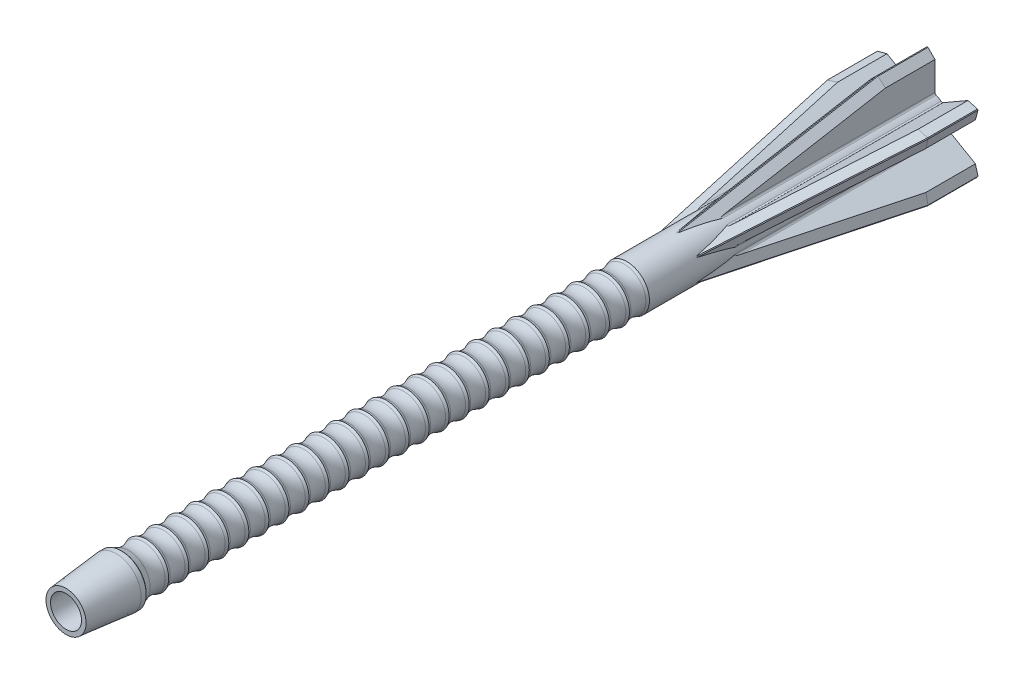
from build123d import *

# Parameters (mm, degrees)
SKETCH_2_R                           = 2.25
EXTRUDE_1_DEPTH                      = 30
FILLET_1_R                           = 2
PATTERN_LINEAR_1_COUNT               = 25
PATTERN_LINEAR_1_PITCH               = 2
FILLET_1_OF_PATTERN_LINEAR_1_R       = 2
SKETCH_6_R                           = 2.5
EXTRUDE_3_DEPTH                      = 6
CHAMFER_1_SIZE                       = 5
CHAMFER_1_SIZE2                      = 0.5
EXTRUDE_4_DEPTH                      = 0.75
CHAMFER_3_SIZE                       = 0.7
PATTERN_CIRCULAR_1_COUNT             = 6
CHAMFER_3_OF_PATTERN_CIRCULAR_1_SIZE = 0.7
SKETCH_10_R                          = 1.5
CUT_EXTRUDE_3_DEPTH                  = 1
CHAMFER_4_SIZE                       = 1
FILLET_3_R                           = 0.2
SKETCH_7_R                           = 1.55
CUT_EXTRUDE_1_DEPTH                  = 60
CHAMFER_6_SIZE                       = 0.4


with BuildPart() as part:
    # 스케치2 → 보스-돌출1 (new body)
    with BuildSketch(Plane.XY):
        Circle(SKETCH_2_R)
    extrude(amount=EXTRUDE_1_DEPTH)

    # 스케치3 → 회전1 (revolve)
    with BuildSketch(Plane(origin=(0, 0, 0), x_dir=(0, 0, -1), z_dir=(1, 0, 0))):
        Polygon((-30, 2.25), (-31, 1.85), (-32, 2.25), (-32, 0), (-30, 0), align=None)
    revolve_1 = revolve(axis=Axis((0, 0, 30), (0, 0, 1)))

    # 필렛1
    fillet_1_edges = [part.edges().sort_by_distance(p)[0] for p in [
        (0, -1.85, 31),
    ]]
    fillet(fillet_1_edges, radius=FILLET_1_R)

    # 선형 패턴1: 회전1 ×25
    with Locations(*[(0, 0, i * PATTERN_LINEAR_1_PITCH) for i in range(1, PATTERN_LINEAR_1_COUNT)]):
        add(revolve_1)

    # 필렛1 of 선형 패턴1
    fillet_1_of_pattern_linear_1_edges = [part.edges().sort_by_distance(p)[0] for p in [
        (0, -1.85, 33),
        (0, -1.85, 35),
        (0, -1.85, 37),
        (0, -1.85, 39),
        (0, -1.85, 41),
        (0, -1.85, 43),
        (0, -1.85, 45),
        (0, -1.85, 47),
        (0, -1.85, 49),
        (0, -1.85, 51),
        (0, -1.85, 53),
        (0, -1.85, 55),
        (0, -1.85, 57),
        (0, -1.85, 59),
        (0, -1.85, 61),
        (0, -1.85, 63),
        (0, -1.85, 65),
        (0, -1.85, 67),
        (0, -1.85, 69),
        (0, -1.85, 71),
        (0, -1.85, 73),
        (0, -1.85, 75),
        (0, -1.85, 77),
        (0, -1.85, 79),
    ]]
    fillet(fillet_1_of_pattern_linear_1_edges, radius=FILLET_1_OF_PATTERN_LINEAR_1_R)

    # 스케치6 → 보스-돌출3 (add)
    with BuildSketch(Plane.XY.offset(80)):
        Circle(SKETCH_6_R)
    extrude(amount=EXTRUDE_3_DEPTH)

    # 모따기1
    chamfer_1_edges = [part.edges().sort_by_distance(p)[0] for p in [
        (-2.5, 0, 86),
    ]]
    chamfer_1_side = [part.faces().sort_by_distance(p)[0] for p in [
        (-2.5, 0, 83),
    ]]
    chamfer(chamfer_1_edges, length=CHAMFER_1_SIZE, length2=CHAMFER_1_SIZE2, reference=chamfer_1_side[0])

    # 모따기2: read off the stored shape, not the designer's step
    # 모따기2 outline → 모따기2 (revolve, cut)
    with BuildSketch(Plane.XZ):
        Polygon((2.416666667, 80.416666667), (2.25, 80), (2.5, 80), (2.5, 80.5), align=None)
    revolve(axis=Axis((0, 0, 0), (0, 0, 1)), mode=Mode.SUBTRACT)

    # 스케치8 → 보스-돌출4 (add, symmetric)
    with BuildSketch(Plane(origin=(0, 0, 0), x_dir=(0, 0, -1), z_dir=(1, 0, 0))):
        Polygon((0, 2.25), (0, 5.8), (-5, 5.8), (-25, 2.25), (-25, 1.021312106), (0, 1.021312106), align=None)
    extrude_4 = extrude(amount=EXTRUDE_4_DEPTH, both=True)

    # 모따기3
    # the kernel refuses this chamfer: 0.7 mm, written as the material it takes off along each edge
    with BuildSketch(Plane(origin=(0.75, 5.8, -1.800178092), x_dir=(0, -1, 0), z_dir=(0, 0, 1))) as chamfer_3_piece_1:
        Polygon((CHAMFER_3_SIZE, 0), (0, -CHAMFER_3_SIZE), (0, 0), align=None)
    extrude(amount=12.200712366, mode=Mode.SUBTRACT)
    with BuildSketch(Plane(origin=(0.75, 6.743841681, -0.31741792), x_dir=(0, -0.9846096051487473, -0.17476820491390266), z_dir=(0, -0.17476820491390266, 0.9846096051487474))) as chamfer_3_piece_2_section:
        Polygon((CHAMFER_3_SIZE, 0), (0, -CHAMFER_3_SIZE), (0, 0), align=None)
    chamfer_3_piece_2 = extrude(amount=27.513331597, mode=Mode.PRIVATE)
    chamfer_3_piece_2 = chamfer_3_piece_2 - Plane(origin=(0, 0, -0.31741792), x_dir=(1, 0, 0), z_dir=(0, 0, -1)) * Cylinder(2.25, 58, mode=Mode.PRIVATE)
    add(chamfer_3_piece_2, mode=Mode.SUBTRACT)
    with BuildSketch(Plane(origin=(-0.75, 5.8, -1.800178092), x_dir=(0, -1, 0), z_dir=(0, 0, 1))) as chamfer_3_piece_3:
        Polygon((CHAMFER_3_SIZE, 0), (0, CHAMFER_3_SIZE), (0, 0), align=None)
    extrude(amount=12.200712366, mode=Mode.SUBTRACT)
    with BuildSketch(Plane(origin=(-0.75, 6.743841681, -0.31741792), x_dir=(0, -0.9846096051487473, -0.17476820491390266), z_dir=(0, -0.17476820491390266, 0.9846096051487474))) as chamfer_3_piece_4_section:
        Polygon((CHAMFER_3_SIZE, 0), (0, CHAMFER_3_SIZE), (0, 0), align=None)
    chamfer_3_piece_4 = extrude(amount=27.513331597, mode=Mode.PRIVATE)
    chamfer_3_piece_4 = chamfer_3_piece_4 - Plane(origin=(0, 0, -0.31741792), x_dir=(1, 0, 0), z_dir=(0, 0, -1)) * Cylinder(2.25, 58, mode=Mode.PRIVATE)
    add(chamfer_3_piece_4, mode=Mode.SUBTRACT)

    # 원형 패턴1: 보스-돌출4 ×6 about axis
    pattern_circular_1_axis = Axis((0, 0, 0), (0, 0, 1))
    for i in range(1, PATTERN_CIRCULAR_1_COUNT):
        add(extrude_4.rotate(pattern_circular_1_axis, i * 360 / PATTERN_CIRCULAR_1_COUNT))

    # 모따기3 of 원형 패턴1
    # the kernel refuses this chamfer: 0.7 mm, written as the material it takes off along each edge
    with BuildSketch(Plane(origin=(-4.647947342, 3.549519053, -1.800178092), x_dir=(0.8660254037844384, -0.5000000000000004, 0), z_dir=(0, 0, 1)), Plane(origin=(-5.397947342, -2.250480947, -1.800178092), x_dir=(0.8660254037844388, 0.49999999999999967, 0), z_dir=(0, 0, 1)), Plane(origin=(-0.75, -5.8, -1.800178092), x_dir=(0, 1, 0), z_dir=(0, 0, 1)), Plane(origin=(4.647947342, -3.549519053, -1.800178092), x_dir=(-0.8660254037844384, 0.5000000000000004, 0), z_dir=(0, 0, 1)), Plane(origin=(5.397947342, 2.250480947, -1.800178092), x_dir=(-0.8660254037844384, -0.5000000000000004, 0), z_dir=(0, 0, 1))) as chamfer_3_of_pattern_circular_1_piece_1:
        Polygon((CHAMFER_3_OF_PATTERN_CIRCULAR_1_SIZE, 0), (0, -CHAMFER_3_OF_PATTERN_CIRCULAR_1_SIZE), (0, 0), align=None)
    extrude(amount=12.200712366, mode=Mode.SUBTRACT)
    with BuildSketch(Plane(origin=(-5.465338215, 4.021439893, -0.31741792), x_dir=(0.8526969308689808, -0.4923048025743734, -0.17476820491390263), z_dir=(0.15135370522924405, -0.08738410245695134, 0.9846096051487474))) as chamfer_3_of_pattern_circular_1_piece_2_section:
        Polygon((CHAMFER_3_OF_PATTERN_CIRCULAR_1_SIZE, 0), (0, -CHAMFER_3_OF_PATTERN_CIRCULAR_1_SIZE), (0, 0), align=None)
    chamfer_3_of_pattern_circular_1_piece_2 = extrude(amount=27.513331597, mode=Mode.PRIVATE)
    chamfer_3_of_pattern_circular_1_piece_2 = chamfer_3_of_pattern_circular_1_piece_2 - Plane(origin=(0, 0, -0.31741792), x_dir=(1, 0, 0), z_dir=(0, 0, -1)) * Cylinder(2.25, 58, mode=Mode.PRIVATE)
    add(chamfer_3_of_pattern_circular_1_piece_2, mode=Mode.SUBTRACT)
    with BuildSketch(Plane(origin=(-5.397947342, 2.250480947, -1.800178092), x_dir=(0.8660254037844382, -0.5000000000000007, 0), z_dir=(0, 0, 1)), Plane(origin=(-4.647947342, -3.549519053, -1.800178092), x_dir=(0.8660254037844389, 0.4999999999999995, 0), z_dir=(0, 0, 1)), Plane(origin=(0.75, -5.8, -1.800178092), x_dir=(0, 1, 0), z_dir=(0, 0, 1)), Plane(origin=(5.397947342, -2.250480947, -1.800178092), x_dir=(-0.8660254037844384, 0.5000000000000004, 0), z_dir=(0, 0, 1)), Plane(origin=(4.647947342, 3.549519053, -1.800178092), x_dir=(-0.8660254037844384, -0.5000000000000004, 0), z_dir=(0, 0, 1))) as chamfer_3_of_pattern_circular_1_piece_3:
        Polygon((CHAMFER_3_OF_PATTERN_CIRCULAR_1_SIZE, 0), (0, CHAMFER_3_OF_PATTERN_CIRCULAR_1_SIZE), (0, 0), align=None)
    extrude(amount=12.200712366, mode=Mode.SUBTRACT)
    with BuildSketch(Plane(origin=(-6.215338215, 2.722401788, -0.31741792), x_dir=(0.8526969308689802, -0.4923048025743744, -0.17476820491390263), z_dir=(0.15135370522924405, -0.08738410245695134, 0.9846096051487474))) as chamfer_3_of_pattern_circular_1_piece_4_section:
        Polygon((CHAMFER_3_OF_PATTERN_CIRCULAR_1_SIZE, 0), (0, CHAMFER_3_OF_PATTERN_CIRCULAR_1_SIZE), (0, 0), align=None)
    chamfer_3_of_pattern_circular_1_piece_4 = extrude(amount=27.513331597, mode=Mode.PRIVATE)
    chamfer_3_of_pattern_circular_1_piece_4 = chamfer_3_of_pattern_circular_1_piece_4 - Plane(origin=(0, 0, -0.31741792), x_dir=(1, 0, 0), z_dir=(0, 0, -1)) * Cylinder(2.25, 58, mode=Mode.PRIVATE)
    add(chamfer_3_of_pattern_circular_1_piece_4, mode=Mode.SUBTRACT)
    with BuildSketch(Plane(origin=(-6.215338215, -2.722401788, -0.31741792), x_dir=(0.8526969308689808, 0.4923048025743734, -0.17476820491390263), z_dir=(0.15135370522924407, 0.08738410245695129, 0.9846096051487474))) as chamfer_3_of_pattern_circular_1_piece_5_section:
        Polygon((CHAMFER_3_OF_PATTERN_CIRCULAR_1_SIZE, 0), (0, -CHAMFER_3_OF_PATTERN_CIRCULAR_1_SIZE), (0, 0), align=None)
    chamfer_3_of_pattern_circular_1_piece_5 = extrude(amount=27.513331597, mode=Mode.PRIVATE)
    chamfer_3_of_pattern_circular_1_piece_5 = chamfer_3_of_pattern_circular_1_piece_5 - Plane(origin=(0, 0, -0.31741792), x_dir=(1, 0, 0), z_dir=(0, 0, -1)) * Cylinder(2.25, 58, mode=Mode.PRIVATE)
    add(chamfer_3_of_pattern_circular_1_piece_5, mode=Mode.SUBTRACT)
    with BuildSketch(Plane(origin=(-5.465338215, -4.021439893, -0.31741792), x_dir=(0.8526969308689808, 0.4923048025743735, -0.17476820491390266), z_dir=(0.15135370522924407, 0.08738410245695129, 0.9846096051487474))) as chamfer_3_of_pattern_circular_1_piece_6_section:
        Polygon((CHAMFER_3_OF_PATTERN_CIRCULAR_1_SIZE, 0), (0, CHAMFER_3_OF_PATTERN_CIRCULAR_1_SIZE), (0, 0), align=None)
    chamfer_3_of_pattern_circular_1_piece_6 = extrude(amount=27.513331597, mode=Mode.PRIVATE)
    chamfer_3_of_pattern_circular_1_piece_6 = chamfer_3_of_pattern_circular_1_piece_6 - Plane(origin=(0, 0, -0.31741792), x_dir=(1, 0, 0), z_dir=(0, 0, -1)) * Cylinder(2.25, 58, mode=Mode.PRIVATE)
    add(chamfer_3_of_pattern_circular_1_piece_6, mode=Mode.SUBTRACT)
    with BuildSketch(Plane(origin=(-0.75, -6.743841681, -0.31741792), x_dir=(0, 0.9846096051487473, -0.17476820491390266), z_dir=(0, 0.17476820491390266, 0.9846096051487474))) as chamfer_3_of_pattern_circular_1_piece_7_section:
        Polygon((CHAMFER_3_OF_PATTERN_CIRCULAR_1_SIZE, 0), (0, -CHAMFER_3_OF_PATTERN_CIRCULAR_1_SIZE), (0, 0), align=None)
    chamfer_3_of_pattern_circular_1_piece_7 = extrude(amount=27.513331597, mode=Mode.PRIVATE)
    chamfer_3_of_pattern_circular_1_piece_7 = chamfer_3_of_pattern_circular_1_piece_7 - Plane(origin=(0, 0, -0.31741792), x_dir=(1, 0, 0), z_dir=(0, 0, -1)) * Cylinder(2.25, 58, mode=Mode.PRIVATE)
    add(chamfer_3_of_pattern_circular_1_piece_7, mode=Mode.SUBTRACT)
    with BuildSketch(Plane(origin=(0.75, -6.743841681, -0.31741792), x_dir=(0, 0.9846096051487473, -0.17476820491390266), z_dir=(0, 0.17476820491390266, 0.9846096051487474))) as chamfer_3_of_pattern_circular_1_piece_8_section:
        Polygon((CHAMFER_3_OF_PATTERN_CIRCULAR_1_SIZE, 0), (0, CHAMFER_3_OF_PATTERN_CIRCULAR_1_SIZE), (0, 0), align=None)
    chamfer_3_of_pattern_circular_1_piece_8 = extrude(amount=27.513331597, mode=Mode.PRIVATE)
    chamfer_3_of_pattern_circular_1_piece_8 = chamfer_3_of_pattern_circular_1_piece_8 - Plane(origin=(0, 0, -0.31741792), x_dir=(1, 0, 0), z_dir=(0, 0, -1)) * Cylinder(2.25, 58, mode=Mode.PRIVATE)
    add(chamfer_3_of_pattern_circular_1_piece_8, mode=Mode.SUBTRACT)
    with BuildSketch(Plane(origin=(5.465338215, -4.021439893, -0.31741792), x_dir=(-0.8526969308689808, 0.4923048025743734, -0.17476820491390266), z_dir=(-0.15135370522924402, 0.08738410245695141, 0.9846096051487474))) as chamfer_3_of_pattern_circular_1_piece_9_section:
        Polygon((CHAMFER_3_OF_PATTERN_CIRCULAR_1_SIZE, 0), (0, -CHAMFER_3_OF_PATTERN_CIRCULAR_1_SIZE), (0, 0), align=None)
    chamfer_3_of_pattern_circular_1_piece_9 = extrude(amount=27.513331597, mode=Mode.PRIVATE)
    chamfer_3_of_pattern_circular_1_piece_9 = chamfer_3_of_pattern_circular_1_piece_9 - Plane(origin=(0, 0, -0.31741792), x_dir=(1, 0, 0), z_dir=(0, 0, -1)) * Cylinder(2.25, 58, mode=Mode.PRIVATE)
    add(chamfer_3_of_pattern_circular_1_piece_9, mode=Mode.SUBTRACT)
    with BuildSketch(Plane(origin=(6.215338215, -2.722401788, -0.31741792), x_dir=(-0.8526969308689806, 0.49230480257437387, -0.17476820491390266), z_dir=(-0.15135370522924402, 0.08738410245695141, 0.9846096051487474))) as chamfer_3_of_pattern_circular_1_piece_10_section:
        Polygon((CHAMFER_3_OF_PATTERN_CIRCULAR_1_SIZE, 0), (0, CHAMFER_3_OF_PATTERN_CIRCULAR_1_SIZE), (0, 0), align=None)
    chamfer_3_of_pattern_circular_1_piece_10 = extrude(amount=27.513331597, mode=Mode.PRIVATE)
    chamfer_3_of_pattern_circular_1_piece_10 = chamfer_3_of_pattern_circular_1_piece_10 - Plane(origin=(0, 0, -0.31741792), x_dir=(1, 0, 0), z_dir=(0, 0, -1)) * Cylinder(2.25, 58, mode=Mode.PRIVATE)
    add(chamfer_3_of_pattern_circular_1_piece_10, mode=Mode.SUBTRACT)
    with BuildSketch(Plane(origin=(6.215338215, 2.722401788, -0.31741792), x_dir=(-0.8526969308689806, -0.49230480257437387, -0.17476820491390266), z_dir=(-0.15135370522924405, -0.08738410245695134, 0.9846096051487474))) as chamfer_3_of_pattern_circular_1_piece_11_section:
        Polygon((CHAMFER_3_OF_PATTERN_CIRCULAR_1_SIZE, 0), (0, -CHAMFER_3_OF_PATTERN_CIRCULAR_1_SIZE), (0, 0), align=None)
    chamfer_3_of_pattern_circular_1_piece_11 = extrude(amount=27.513331597, mode=Mode.PRIVATE)
    chamfer_3_of_pattern_circular_1_piece_11 = chamfer_3_of_pattern_circular_1_piece_11 - Plane(origin=(0, 0, -0.31741792), x_dir=(1, 0, 0), z_dir=(0, 0, -1)) * Cylinder(2.25, 58, mode=Mode.PRIVATE)
    add(chamfer_3_of_pattern_circular_1_piece_11, mode=Mode.SUBTRACT)
    with BuildSketch(Plane(origin=(5.465338215, 4.021439893, -0.31741792), x_dir=(-0.8526969308689802, -0.4923048025743744, -0.17476820491390263), z_dir=(-0.15135370522924405, -0.08738410245695134, 0.9846096051487474))) as chamfer_3_of_pattern_circular_1_piece_12_section:
        Polygon((CHAMFER_3_OF_PATTERN_CIRCULAR_1_SIZE, 0), (0, CHAMFER_3_OF_PATTERN_CIRCULAR_1_SIZE), (0, 0), align=None)
    chamfer_3_of_pattern_circular_1_piece_12 = extrude(amount=27.513331597, mode=Mode.PRIVATE)
    chamfer_3_of_pattern_circular_1_piece_12 = chamfer_3_of_pattern_circular_1_piece_12 - Plane(origin=(0, 0, -0.31741792), x_dir=(1, 0, 0), z_dir=(0, 0, -1)) * Cylinder(2.25, 58, mode=Mode.PRIVATE)
    add(chamfer_3_of_pattern_circular_1_piece_12, mode=Mode.SUBTRACT)

    # 스케치10 → 컷-돌출3 (cut)
    with BuildSketch(Plane.XY):
        Circle(SKETCH_10_R)
    extrude(amount=CUT_EXTRUDE_3_DEPTH, mode=Mode.SUBTRACT)

    # 모따기4
    chamfer_4_edges = [part.edges().sort_by_distance(p)[0] for p in [
        (-1.5, 0, 1),
    ]]
    chamfer(chamfer_4_edges, length=CHAMFER_4_SIZE - 0.0001)  # a hair under: the kernel refuses the full size

    # 필렛3
    # the kernel refuses this fillet: 0.2 mm, written as the material it adds along each edge
    with BuildSketch(Plane(origin=(-0.75, 2.121320344, 22.062144647), x_dir=(0, 1, 0), z_dir=(0, 0, -1))) as fillet_3_piece_1_section:
        with BuildLine():
            CenterArc((0.136997615, -0.2), FILLET_3_R, 90, 67.185112777)
            ThreePointArc((-0.047354872, -0.12244898), (-0.022784138, -0.061569956), (0, 0))
            Line((0, 0), (0.136997615, 0))
        make_face()
    fillet_3_piece_1 = extrude(amount=22.062144647, mode=Mode.PRIVATE)
    fillet_3_piece_1 = split(fillet_3_piece_1, bisect_by=Plane(origin=(-0.720071466, 2.091852422, 22.056914091), z_dir=(0.7071067811865476, -0.6962241286220819, -0.12357978283045665)), keep=Keep.TOP, mode=Mode.PRIVATE)
    add(fillet_3_piece_1)
    with BuildSketch(Plane(origin=(0.75, 2.121320344, 22.062144647), x_dir=(0.9326827580412956, -0.3606977583136353, 0), z_dir=(0, 0, -1))) as fillet_3_piece_2_section:
        with BuildLine():
            CenterArc((0.137121819, -0.199914865), FILLET_3_R, 91.671833294, 67.185112777)
            Line((-0.049414732, -0.127775313), (0, 0))
            ThreePointArc((0, 0), (0.065643424, -0.000957773), (0.131286848, 0))
        make_face()
    fillet_3_piece_2 = extrude(amount=22.062144647, mode=Mode.PRIVATE)
    fillet_3_piece_2 = split(fillet_3_piece_2, bisect_by=Plane(origin=(0.720071466, 2.091852422, 22.056914091), z_dir=(-0.7071067811865476, -0.6962241286220819, -0.12357978283045665)), keep=Keep.TOP, mode=Mode.PRIVATE)
    add(fillet_3_piece_2)
    with BuildSketch(Plane(origin=(1.462117307, 1.710179225, 22.062144647), x_dir=(-0.7787148008083566, 0.6273780829786785, 0), z_dir=(0, 0, -1))) as fillet_3_piece_3_section:
        with BuildLine():
            CenterArc((0.137121819, 0.199914865), FILLET_3_R, 201.143053929, 67.185112777)
            Line((-0.049414732, 0.127775313), (0, 0))
            ThreePointArc((0, 0), (0.065643424, 0.000957773), (0.131286848, 0))
        make_face()
    fillet_3_piece_3 = extrude(amount=22.062144647, mode=Mode.PRIVATE)
    fillet_3_piece_3 = split(fillet_3_piece_3, bisect_by=Plane(origin=(1.451561605, 1.669526393, 22.056914091), z_dir=(-0.2493943915214648, -0.9604845000067547, -0.12357978283041723)), keep=Keep.TOP, mode=Mode.PRIVATE)
    add(fillet_3_piece_3)
    with BuildSketch(Plane(origin=(2.212117307, -0.411141119, 22.062144647), x_dir=(0.15396795723294227, 0.9880758412923143, 0), z_dir=(0, 0, -1))) as fillet_3_piece_4_section:
        with BuildLine():
            CenterArc((0.137121819, 0.199914865), FILLET_3_R, 201.143053929, 67.185112777)
            Line((-0.049414732, 0.127775313), (0, 0))
            ThreePointArc((0, 0), (0.065643424, 0.000957773), (0.131286848, 0))
        make_face()
    fillet_3_piece_4 = extrude(amount=22.062144647, mode=Mode.PRIVATE)
    fillet_3_piece_4 = split(fillet_3_piece_4, bisect_by=Plane(origin=(2.171633071, -0.422326029, 22.056914091), z_dir=(-0.9565011727076457, -0.2642603713850465, -0.12357978283010622)), keep=Keep.TOP, mode=Mode.PRIVATE)
    add(fillet_3_piece_4)
    with BuildSketch(Plane(origin=(0.75, -2.121320344, 22.062144647), x_dir=(0.9326827580412977, 0.3606977583136301, 0), z_dir=(0, 0, -1))) as fillet_3_piece_5_section:
        with BuildLine():
            CenterArc((0.137121819, 0.199914865), FILLET_3_R, 201.143053929, 67.185112777)
            Line((-0.049414732, 0.127775313), (0, 0))
            ThreePointArc((0, 0), (0.065643424, 0.000957773), (0.131286848, 0))
        make_face()
    fillet_3_piece_5 = extrude(amount=22.062144647, mode=Mode.PRIVATE)
    fillet_3_piece_5 = split(fillet_3_piece_5, bisect_by=Plane(origin=(0.720071466, -2.091852422, 22.056914091), z_dir=(-0.7071067811865476, 0.6962241286220819, -0.12357978283045665)), keep=Keep.TOP, mode=Mode.PRIVATE)
    add(fillet_3_piece_5)
    with BuildSketch(Plane(origin=(-1.462117307, -1.710179225, 22.062144647), x_dir=(0.7787148008083525, -0.6273780829786836, 0), z_dir=(0, 0, -1))) as fillet_3_piece_6_section:
        with BuildLine():
            CenterArc((0.137121819, 0.199914865), FILLET_3_R, 201.143053929, 67.185112777)
            Line((-0.049414732, 0.127775313), (0, 0))
            ThreePointArc((0, 0), (0.065643424, 0.000957773), (0.131286848, 0))
        make_face()
    fillet_3_piece_6 = extrude(amount=22.062144647, mode=Mode.PRIVATE)
    fillet_3_piece_6 = split(fillet_3_piece_6, bisect_by=Plane(origin=(-1.451561605, -1.669526393, 22.056914091), z_dir=(0.2493943915214648, 0.9604845000067547, -0.12357978283041723)), keep=Keep.TOP, mode=Mode.PRIVATE)
    add(fillet_3_piece_6)
    with BuildSketch(Plane(origin=(-2.212117307, 0.411141119, 22.062144647), x_dir=(-0.15396795723294326, -0.9880758412923143, 0), z_dir=(0, 0, -1))) as fillet_3_piece_7_section:
        with BuildLine():
            CenterArc((0.137121819, 0.199914865), FILLET_3_R, 201.143053929, 67.185112777)
            Line((-0.049414732, 0.127775313), (0, 0))
            ThreePointArc((0, 0), (0.065643424, 0.000957773), (0.131286848, 0))
        make_face()
    fillet_3_piece_7 = extrude(amount=22.062144647, mode=Mode.PRIVATE)
    fillet_3_piece_7 = split(fillet_3_piece_7, bisect_by=Plane(origin=(-2.171633071, 0.422326029, 22.056914091), z_dir=(0.9565011727076457, 0.2642603713850465, -0.12357978283010622)), keep=Keep.TOP, mode=Mode.PRIVATE)
    add(fillet_3_piece_7)
    with BuildSketch(Plane(origin=(2.212117307, 0.411141119, 22.062144647), x_dir=(0.15396795723294326, -0.9880758412923143, 0), z_dir=(0, 0, -1))) as fillet_3_piece_8_section:
        with BuildLine():
            CenterArc((0.137121819, -0.199914865), FILLET_3_R, 91.671833294, 67.185112777)
            Line((-0.049414732, -0.127775313), (0, 0))
            ThreePointArc((0, 0), (0.065643424, -0.000957773), (0.131286848, 0))
        make_face()
    fillet_3_piece_8 = extrude(amount=22.062144647, mode=Mode.PRIVATE)
    fillet_3_piece_8 = split(fillet_3_piece_8, bisect_by=Plane(origin=(2.171633071, 0.422326029, 22.056914091), z_dir=(-0.9565011727076457, 0.2642603713850465, -0.12357978283010622)), keep=Keep.TOP, mode=Mode.PRIVATE)
    add(fillet_3_piece_8)
    with BuildSketch(Plane(origin=(1.462117307, -1.710179225, 22.062144647), x_dir=(-0.7787148008083543, -0.6273780829786814, 0), z_dir=(0, 0, -1))) as fillet_3_piece_9_section:
        with BuildLine():
            CenterArc((0.137121819, -0.199914865), FILLET_3_R, 91.671833294, 67.185112777)
            Line((-0.049414732, -0.127775313), (0, 0))
            ThreePointArc((0, 0), (0.065643424, -0.000957773), (0.131286848, 0))
        make_face()
    fillet_3_piece_9 = extrude(amount=22.062144647, mode=Mode.PRIVATE)
    fillet_3_piece_9 = split(fillet_3_piece_9, bisect_by=Plane(origin=(1.451561605, -1.669526393, 22.056914091), z_dir=(-0.2493943915214648, 0.9604845000067547, -0.12357978283041723)), keep=Keep.TOP, mode=Mode.PRIVATE)
    add(fillet_3_piece_9)
    with BuildSketch(Plane(origin=(-0.75, -2.121320344, 22.062144647), x_dir=(-0.9326827580412947, 0.3606977583136383, 0), z_dir=(0, 0, -1))) as fillet_3_piece_10_section:
        with BuildLine():
            CenterArc((0.137121819, -0.199914865), FILLET_3_R, 91.671833294, 67.185112777)
            Line((-0.049414732, -0.127775313), (0, 0))
            ThreePointArc((0, 0), (0.065643424, -0.000957773), (0.131286848, 0))
        make_face()
    fillet_3_piece_10 = extrude(amount=22.062144647, mode=Mode.PRIVATE)
    fillet_3_piece_10 = split(fillet_3_piece_10, bisect_by=Plane(origin=(-0.720071466, -2.091852422, 22.056914091), z_dir=(0.7071067811865476, 0.6962241286220819, -0.12357978283045665)), keep=Keep.TOP, mode=Mode.PRIVATE)
    add(fillet_3_piece_10)
    with BuildSketch(Plane(origin=(-2.212117307, -0.411141119, 22.062144647), x_dir=(-0.15396795723293716, 0.9880758412923151, 0), z_dir=(0, 0, -1))) as fillet_3_piece_11_section:
        with BuildLine():
            CenterArc((0.137121819, -0.199914865), FILLET_3_R, 91.671833294, 67.185112777)
            Line((-0.049414732, -0.127775313), (0, 0))
            ThreePointArc((0, 0), (0.065643424, -0.000957773), (0.131286848, 0))
        make_face()
    fillet_3_piece_11 = extrude(amount=22.062144647, mode=Mode.PRIVATE)
    fillet_3_piece_11 = split(fillet_3_piece_11, bisect_by=Plane(origin=(-2.171633071, -0.422326029, 22.056914091), z_dir=(0.9565011727076457, -0.2642603713850465, -0.12357978283010622)), keep=Keep.TOP, mode=Mode.PRIVATE)
    add(fillet_3_piece_11)
    with BuildSketch(Plane(origin=(-1.462117307, 1.710179225, 22.062144647), x_dir=(0.7787148008083566, 0.6273780829786785, 0), z_dir=(0, 0, -1))) as fillet_3_piece_12_section:
        with BuildLine():
            CenterArc((0.137121819, -0.199914865), FILLET_3_R, 91.671833294, 67.185112777)
            Line((-0.049414732, -0.127775313), (0, 0))
            ThreePointArc((0, 0), (0.065643424, -0.000957773), (0.131286848, 0))
        make_face()
    fillet_3_piece_12 = extrude(amount=22.062144647, mode=Mode.PRIVATE)
    fillet_3_piece_12 = split(fillet_3_piece_12, bisect_by=Plane(origin=(-1.451561605, 1.669526393, 22.056914091), z_dir=(0.2493943915214648, -0.9604845000067547, -0.12357978283041723)), keep=Keep.TOP, mode=Mode.PRIVATE)
    add(fillet_3_piece_12)

    # 스케치7 → 컷-돌출1 (cut)
    with BuildSketch(Plane.XY.offset(86)):
        Circle(SKETCH_7_R)
    extrude(amount=-CUT_EXTRUDE_1_DEPTH, mode=Mode.SUBTRACT)

    # 모따기6
    chamfer_6_edges = [part.edges().sort_by_distance(p)[0] for p in [
        (-1.55, 0, 26),
    ]]
    chamfer(chamfer_6_edges, length=CHAMFER_6_SIZE)


solid = part.part
